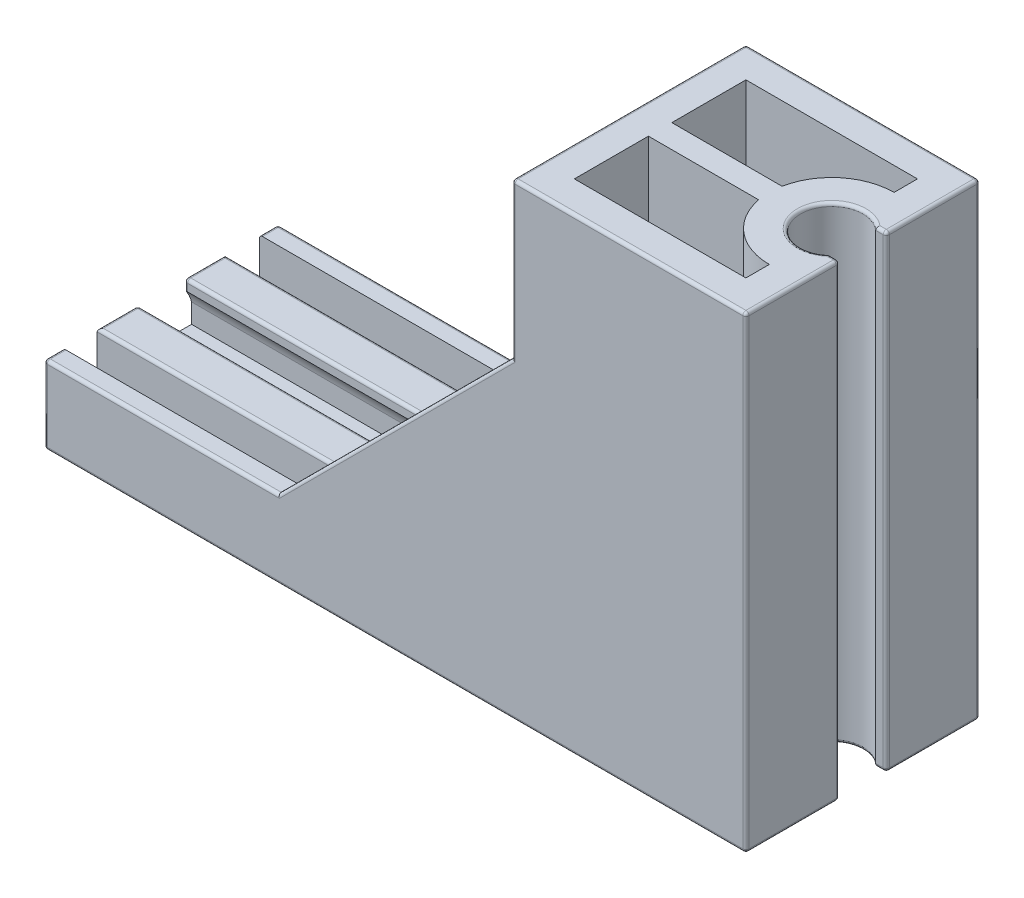
from build123d import *

# Parameters (mm, degrees)
SKETCH_1_W                     = 15
SKETCH_1_H                     = 15
EXTRUDE_1_DEPTH                = 30
CUT_EXTRUDE_1_DEPTH            = 32.819805153
SKETCH_3_W                     = 15
SKETCH_3_H                     = 5
EXTRUDE_2_DEPTH                = 30
SKETCH_4_W                     = 2.2
SKETCH_4_H                     = 2.8
CUT_EXTRUDE_2_DEPTH            = 30
CUT_EXTRUDE_3_DEPTH            = 28.5
EXTRUDE_3_DEPTH                = 3
CUT_EXTRUDE_4_DEPTH            = 15
FILLET_1_R                     = 0.1
PATTERN_LINEAR_1_COUNT         = 3
PATTERN_LINEAR_1_PITCH         = 15
FILLET_1_OF_PATTERN_LINEAR_1_R = 0.1
EXTRUDE_4_DEPTH                = 1.2
FILLET_3_R                     = 0.2
FILLET_4_R                     = 0.2
FILLET_5_R                     = 0.2
FILLET_6_R                     = 0.2
FILLET_7_R                     = 0.2
FILLET_8_R                     = 0.2


with BuildPart() as part:
    # 草图1 → 凸台-拉伸1 (new body)
    with BuildSketch(Plane(origin=(0, 0, 0), x_dir=(1, 0, 0), z_dir=(0, 1, 0))):
        Rectangle(SKETCH_1_W, SKETCH_1_H)
    extrude(amount=EXTRUDE_1_DEPTH)

    # 草图2 → 切除-拉伸1 (cut, through all)
    with BuildSketch(Plane(origin=(0, 30, 0), x_dir=(1, 0, 0), z_dir=(0, 1, 0))):
        with BuildLine():
            Line((7.5, -1.5), (7.5, 1.5))
            Line((7.5, 1.5), (6.822875656, 1.5))
            ThreePointArc((6.822875656, 1.5), (3.5, 0), (6.822875656, -1.5))
            Line((6.822875656, -1.5), (7.5, -1.5))
        make_face()
    extrude(amount=-CUT_EXTRUDE_1_DEPTH, mode=Mode.SUBTRACT)

    # 草图3 → 凸台-拉伸2 (add)
    with BuildSketch(Plane.ZY.offset(7.5)):
        with Locations((0, 2.5)):
            Rectangle(SKETCH_3_W, SKETCH_3_H)
    extrude(amount=EXTRUDE_2_DEPTH)

    # 草图4 → 切除-拉伸2 (cut)
    with BuildSketch(Plane.ZY.offset(37.5)):
        with BuildLine():
            Line((-1.5, 5), (1.5, 5))
            Line((1.5, 5), (1.5, 4.322875656))
            ThreePointArc((1.5, 4.322875656), (1.780042303, 3.911838473), (1.95, 3.444409721))
            Line((1.95, 3.444409721), (1.95, 2.2))
            Line((1.95, 2.2), (-1.95, 2.2))
            Line((-1.95, 2.2), (-1.95, 3.444409721))
            ThreePointArc((-1.95, 3.444409721), (-1.780042303, 3.911838473), (-1.5, 4.322875656))
            Line((-1.5, 4.322875656), (-1.5, 5))
        make_face()
        with Locations((5.2, 3.6)):
            Rectangle(SKETCH_4_W, SKETCH_4_H)
        with Locations((-5.2, 3.6)):
            Rectangle(SKETCH_4_W, SKETCH_4_H)
    extrude(amount=-CUT_EXTRUDE_2_DEPTH, mode=Mode.SUBTRACT)

    # 草图5 → 切除-拉伸3 (cut)
    with BuildSketch(Plane(origin=(0, 30, 0), x_dir=(1, 0, 0), z_dir=(0, 1, 0))):
        with BuildLine():
            Line((5.5, -5.5), (5.5, -4))
            ThreePointArc((5.5, -4), (2.951667212, -3.083180176), (1.571515432, -0.753))
            Line((1.571515432, -0.753), (-5.5, -0.753))
            Line((-5.5, -0.753), (-5.5, -5.5))
            Line((-5.5, -5.5), (5.5, -5.5))
        make_face()
        with BuildLine():
            Line((5.5, 4), (5.5, 5.5))
            Line((5.5, 5.5), (-5.5, 5.5))
            Line((-5.5, 5.5), (-5.5, 0.75))
            Line((-5.5, 0.75), (1.570941589, 0.75))
            ThreePointArc((1.570941589, 0.75), (2.950490243, 3.082207001), (5.5, 4))
        make_face()
    extrude(amount=-CUT_EXTRUDE_3_DEPTH, mode=Mode.SUBTRACT)

    # 草图6 → 凸台-拉伸3 (add, symmetric)
    with BuildSketch(Plane.XY):
        with BuildLine():
            Line((-31.5, 0), (-28.5, 0))
            Line((-28.5, 0), (-28.5, -0.677124344))
            ThreePointArc((-28.5, -0.677124344), (-28.219957697, -1.088161527), (-28.05, -1.555590279))
            Line((-28.05, -1.555590279), (-28.05, -2.5))
            Line((-28.05, -2.5), (-31.95, -2.5))
            Line((-31.95, -2.5), (-31.95, -1.555590279))
            ThreePointArc((-31.95, -1.555590279), (-31.780042303, -1.088161527), (-31.5, -0.677124344))
            Line((-31.5, -0.677124344), (-31.5, 0))
        make_face()
    extrude_3 = extrude(amount=EXTRUDE_3_DEPTH, both=True)

    # 草图7 → 切除-拉伸4 (cut)
    with BuildSketch(Plane.ZY.offset(37.5)):
        with BuildLine():
            Line((3, -2.5), (1.95, -2.5))
            Line((1.95, -2.5), (1.95, -1.555590279))
            ThreePointArc((1.95, -1.555590279), (1.780042303, -1.088161527), (1.5, -0.677124344))
            Line((1.5, -0.677124344), (1.5, 0))
            Line((1.5, 0), (3, 0))
            Line((3, 0), (3, -2.5))
        make_face()
        with BuildLine():
            Line((-1.5, 0), (-1.5, -0.677124344))
            ThreePointArc((-1.5, -0.677124344), (-1.780042303, -1.088161527), (-1.95, -1.555590279))
            Line((-1.95, -1.555590279), (-1.95, -2.5))
            Line((-1.95, -2.5), (-3, -2.5))
            Line((-3, -2.5), (-3, 0))
            Line((-3, 0), (-1.5, 0))
        make_face()
    cut_extrude_4 = extrude(amount=-CUT_EXTRUDE_4_DEPTH, mode=Mode.SUBTRACT)

    # 圆角1
    fillet_1_edges = [part.edges().sort_by_distance(p)[0] for p in [
        (-30, -2.5, 1.95),
        (-31.95, -2.5, 0),
        (-28.05, -2.5, 0),
        (-30, -2.5, -1.95),
    ]]
    fillet(fillet_1_edges, radius=FILLET_1_R)

    # 阵列(线性)1: 凸台-拉伸3, 切除-拉伸4 ×3
    with Locations(*[(i * PATTERN_LINEAR_1_PITCH, 0, 0) for i in range(1, PATTERN_LINEAR_1_COUNT)]):
        add(extrude_3)
        add(cut_extrude_4, mode=Mode.SUBTRACT)

    # 圆角1 of 阵列(线性)1
    fillet_1_of_pattern_linear_1_edges = [part.edges().sort_by_distance(p)[0] for p in [
        (-15, -2.5, 1.95),
        (-16.95, -2.5, 0),
        (-13.05, -2.5, 0),
        (-15, -2.5, -1.95),
        (0, -2.5, 1.95),
        (-1.95, -2.5, 0),
        (1.95, -2.5, 0),
        (0, -2.5, -1.95),
    ]]
    fillet(fillet_1_of_pattern_linear_1_edges, radius=FILLET_1_OF_PATTERN_LINEAR_1_R)

    # 草图8 → 凸台-拉伸4 (add)
    with BuildSketch(Plane.XY.offset(7.5)):
        Polygon((-7.5, 5), (-7.5, 20), (-22.5, 5), align=None)
    extrude_4 = extrude(amount=-EXTRUDE_4_DEPTH)

    # 镜向1: 凸台-拉伸4 across plane
    add(extrude_4.mirror(Plane.XY))

    # 圆角3
    fillet_3_edges = [part.edges().sort_by_distance(p)[0] for p in [
        (7.5, 15, 1.5),
        (7.5, 15, -1.5),
    ]]
    fillet(fillet_3_edges, radius=FILLET_3_R)

    # 圆角4
    fillet_4_edges = [part.edges().sort_by_distance(p)[0] for p in [
        (0, 30, -7.5),
        (7.5, 30, -4.6),
        (7.441421356, 30, -1.558578644),
        (7.061437828, 30, -1.5),
        (3.5, 30, 0),
        (7.061437828, 30, 1.5),
        (7.441421356, 30, 1.558578644),
        (7.5, 30, 4.6),
        (0, 30, 7.5),
        (-7.5, 30, 0),
    ]]
    fillet(fillet_4_edges, radius=FILLET_4_R)

    # 圆角5
    # the kernel refuses this fillet: 0.2 mm, written as the material it takes off along each edge
    with BuildSketch(Plane(origin=(7.3, 29.8, 7.3), x_dir=(0, 0, 1), z_dir=(1, 0, 0))) as fillet_5_piece_1_section:
        Polygon((0, 0), (FILLET_5_R, 0), (FILLET_5_R, -FILLET_5_R), (0, -FILLET_5_R), align=None)
    fillet_5_piece_1 = extrude(amount=FILLET_5_R, mode=Mode.PRIVATE)
    fillet_5_piece_1 = fillet_5_piece_1 - Plane(origin=(7.3, 29.8, 7.3), x_dir=(0, -0.7071067811865475, -0.7071067811865475), z_dir=(1, 0, 0)) * Sphere(FILLET_5_R, mode=Mode.PRIVATE)
    add(fillet_5_piece_1, mode=Mode.SUBTRACT)
    with BuildSketch(Plane(origin=(7.3, 29.8, -7.3), x_dir=(1, 0, 0), z_dir=(0, 0, -1))) as fillet_5_piece_2_section:
        Polygon((0, 0), (FILLET_5_R, 0), (FILLET_5_R, -FILLET_5_R), (0, -FILLET_5_R), align=None)
    fillet_5_piece_2 = extrude(amount=FILLET_5_R, mode=Mode.PRIVATE)
    fillet_5_piece_2 = fillet_5_piece_2 - Plane(origin=(7.3, 29.8, -7.3), x_dir=(-0.7071067811865475, -0.7071067811865475, 0), z_dir=(0, 0, -1)) * Sphere(FILLET_5_R, mode=Mode.PRIVATE)
    add(fillet_5_piece_2, mode=Mode.SUBTRACT)
    with BuildSketch(Plane(origin=(7.3, 0.2, -7.3), x_dir=(0, -1, 0), z_dir=(0, 0, -1))) as fillet_5_piece_3_section:
        Polygon((0, 0), (FILLET_5_R, 0), (FILLET_5_R, -FILLET_5_R), (0, -FILLET_5_R), align=None)
    fillet_5_piece_3 = extrude(amount=FILLET_5_R, mode=Mode.PRIVATE)
    fillet_5_piece_3 = fillet_5_piece_3 - Plane(origin=(7.3, 0.2, -7.3), x_dir=(-0.7071067811865475, 0.7071067811865475, 0), z_dir=(0, 0, -1)) * Sphere(FILLET_5_R, mode=Mode.PRIVATE)
    add(fillet_5_piece_3, mode=Mode.SUBTRACT)
    with BuildSketch(Plane(origin=(7.3, 0.2, 7.3), x_dir=(0, -1, 0), z_dir=(1, 0, 0))) as fillet_5_piece_4_section:
        Polygon((0, 0), (FILLET_5_R, 0), (FILLET_5_R, -FILLET_5_R), (0, -FILLET_5_R), align=None)
    fillet_5_piece_4 = extrude(amount=FILLET_5_R, mode=Mode.PRIVATE)
    fillet_5_piece_4 = fillet_5_piece_4 - Plane(origin=(7.3, 0.2, 7.3), x_dir=(0, 0.7071067811865475, -0.7071067811865475), z_dir=(1, 0, 0)) * Sphere(FILLET_5_R, mode=Mode.PRIVATE)
    add(fillet_5_piece_4, mode=Mode.SUBTRACT)
    with BuildSketch(Plane(origin=(6.322875656, 0, 1.5), x_dir=(0, 0, 1), z_dir=(1, 0, 0)), Plane(origin=(7.3, 0, -1.5), x_dir=(0, 0, -1), z_dir=(-1, 0, 0))) as fillet_5_piece_5:
        with BuildLine():
            CenterArc((FILLET_5_R, -FILLET_5_R), FILLET_5_R, 90, 90)
            Line((0, -FILLET_5_R), (0, 0))
            Line((0, 0), (FILLET_5_R, 0))
        make_face()
    extrude(amount=0.977124344, mode=Mode.SUBTRACT)
    with BuildSketch(Plane(origin=(5.5, 0, 0), x_dir=(0.8269112079398371, 0, -0.562332512116701), z_dir=(0.562332512116701, 0, 0.8269112079398371))) as fillet_5_piece_6:
        with BuildLine():
            CenterArc((2 + FILLET_5_R, FILLET_5_R), FILLET_5_R, 180, 90)
            Line((2, FILLET_5_R), (2, 0))
            Line((2, 0), (2 + FILLET_5_R, 0))
        make_face()
    revolve(axis=Axis((5.5, 0, 0), (0, 1, 0)), revolution_arc=291.56547905, mode=Mode.SUBTRACT)
    with BuildSketch(Plane(origin=(-37.5, 0, 8), x_dir=(1, 0, 0), z_dir=(0, 0, -1))) as fillet_5_piece_7:
        with BuildLine():
            CenterArc((FILLET_5_R, -FILLET_5_R), FILLET_5_R, 90, 90)
            Line((0, -FILLET_5_R), (0, 0))
            Line((0, 0), (FILLET_5_R, 0))
        make_face()
    extrude(amount=16, mode=Mode.SUBTRACT)
    with BuildSketch(Plane(origin=(7.5, 0, -7.3), x_dir=(-1, 0, 0), z_dir=(0, 0, 1))) as fillet_5_piece_8:
        with BuildLine():
            CenterArc((FILLET_5_R, -FILLET_5_R), FILLET_5_R, 90, 90)
            Line((0, -FILLET_5_R), (0, 0))
            Line((0, 0), (FILLET_5_R, 0))
        make_face()
    extrude(amount=5.6, mode=Mode.SUBTRACT)
    with BuildSketch(Plane(origin=(7.3, 0, -1.7), x_dir=(1, 0, 0), z_dir=(0, 0, -1))) as fillet_5_piece_9:
        with BuildLine():
            CenterArc((0.2 - FILLET_5_R, -FILLET_5_R), FILLET_5_R, 0, 90)
            Line((0.2, -FILLET_5_R), (0.2, 0))
            Line((0.2, 0), (0.2 - FILLET_5_R, 0))
        make_face()
    revolve(axis=Axis((7.3, 0, -1.7), (0, -1, 0)), revolution_arc=90, mode=Mode.SUBTRACT)
    with BuildSketch(Plane(origin=(7.3, 0, 1.7), x_dir=(0, 0, -1), z_dir=(-1, 0, 0))) as fillet_5_piece_10:
        with BuildLine():
            CenterArc((0.2 - FILLET_5_R, -FILLET_5_R), FILLET_5_R, 0, 90)
            Line((0.2 - FILLET_5_R, 0), (0.2, 0))
            Line((0.2, 0), (0.2, -FILLET_5_R))
        make_face()
    revolve(axis=Axis((7.3, 0, 1.7), (0, -1, 0)), revolution_arc=90, mode=Mode.SUBTRACT)
    with BuildSketch(Plane(origin=(7.5, 0.2, -7.5), x_dir=(-1, 0, 0), z_dir=(0, 1, 0)), Plane(origin=(7.5, 0.2, 7.5), x_dir=(0, 0, -1), z_dir=(0, 1, 0))) as fillet_5_piece_11:
        with BuildLine():
            CenterArc((FILLET_5_R, FILLET_5_R), FILLET_5_R, 180, 90)
            Line((0, FILLET_5_R), (0, 0))
            Line((0, 0), (FILLET_5_R, 0))
        make_face()
    extrude(amount=29.6, mode=Mode.SUBTRACT)
    with BuildSketch(Plane(origin=(-38, 0, -7.5), x_dir=(0, 0, 1), z_dir=(1, 0, 0)), Plane(origin=(7.3, 0, 7.5), x_dir=(0, 0, -1), z_dir=(-1, 0, 0))) as fillet_5_piece_12:
        with BuildLine():
            CenterArc((FILLET_5_R, -FILLET_5_R), FILLET_5_R, 90, 90)
            Line((0, -FILLET_5_R), (0, 0))
            Line((0, 0), (FILLET_5_R, 0))
        make_face()
    extrude(amount=45.3, mode=Mode.SUBTRACT)
    with BuildSketch(Plane(origin=(7.5, 0, 1.7), x_dir=(0, 1, 0), z_dir=(0, 0, 1))) as fillet_5_piece_13:
        with BuildLine():
            CenterArc((FILLET_5_R, FILLET_5_R), FILLET_5_R, 180, 90)
            Line((0, FILLET_5_R), (0, 0))
            Line((0, 0), (FILLET_5_R, 0))
        make_face()
    extrude(amount=5.6, mode=Mode.SUBTRACT)

    # 圆角6
    # the kernel refuses this fillet: 0.2 mm, written as the material it takes off along each edge
    with BuildSketch(Plane(origin=(-7.3, 29.8, 7.3), x_dir=(-1, 0, 0), z_dir=(0, 0, 1))) as fillet_6_piece_1_section:
        Polygon((0, 0), (FILLET_6_R, 0), (FILLET_6_R, -FILLET_6_R), (0, -FILLET_6_R), align=None)
    fillet_6_piece_1 = extrude(amount=FILLET_6_R, mode=Mode.PRIVATE)
    fillet_6_piece_1 = fillet_6_piece_1 - Plane(origin=(-7.3, 29.8, 7.3), x_dir=(0.7071067811865475, -0.7071067811865475, 0), z_dir=(0, 0, 1)) * Sphere(FILLET_6_R, mode=Mode.PRIVATE)
    add(fillet_6_piece_1, mode=Mode.SUBTRACT)
    with BuildSketch(Plane(origin=(-7.3, 29.8, -7.3), x_dir=(0, 0, -1), z_dir=(-1, 0, 0))) as fillet_6_piece_2_section:
        Polygon((0, 0), (FILLET_6_R, 0), (FILLET_6_R, -FILLET_6_R), (0, -FILLET_6_R), align=None)
    fillet_6_piece_2 = extrude(amount=FILLET_6_R, mode=Mode.PRIVATE)
    fillet_6_piece_2 = fillet_6_piece_2 - Plane(origin=(-7.3, 29.8, -7.3), x_dir=(0, -0.7071067811865475, 0.7071067811865475), z_dir=(-1, 0, 0)) * Sphere(FILLET_6_R, mode=Mode.PRIVATE)
    add(fillet_6_piece_2, mode=Mode.SUBTRACT)
    with BuildSketch(Plane(origin=(-37.3, 0.2, 7.3), x_dir=(-1, 0, 0), z_dir=(0, 0, 1))) as fillet_6_piece_3_section:
        Polygon((0, 0), (FILLET_6_R, 0), (FILLET_6_R, FILLET_6_R), (0, FILLET_6_R), align=None)
    fillet_6_piece_3 = extrude(amount=FILLET_6_R, mode=Mode.PRIVATE)
    fillet_6_piece_3 = fillet_6_piece_3 - Plane(origin=(-37.3, 0.2, 7.3), x_dir=(0.7071067811865475, 0.7071067811865475, 0), z_dir=(0, 0, 1)) * Sphere(FILLET_6_R, mode=Mode.PRIVATE)
    add(fillet_6_piece_3, mode=Mode.SUBTRACT)
    with BuildSketch(Plane(origin=(-37.3, 0.2, -7.3), x_dir=(0, 0, -1), z_dir=(-1, 0, 0))) as fillet_6_piece_4_section:
        Polygon((0, 0), (FILLET_6_R, 0), (FILLET_6_R, FILLET_6_R), (0, FILLET_6_R), align=None)
    fillet_6_piece_4 = extrude(amount=FILLET_6_R, mode=Mode.PRIVATE)
    fillet_6_piece_4 = fillet_6_piece_4 - Plane(origin=(-37.3, 0.2, -7.3), x_dir=(0, 0.7071067811865475, 0.7071067811865475), z_dir=(-1, 0, 0)) * Sphere(FILLET_6_R, mode=Mode.PRIVATE)
    add(fillet_6_piece_4, mode=Mode.SUBTRACT)
    with BuildSketch(Plane(origin=(-22, 5, -7.5), x_dir=(0, -1, 0), z_dir=(-1, 0, 0))) as fillet_6_piece_5_section:
        with BuildLine():
            CenterArc((FILLET_6_R, FILLET_6_R), FILLET_6_R, 180, 90)
            Line((0, FILLET_6_R), (0, 0))
            Line((0, 0), (FILLET_6_R, 0))
        make_face()
    fillet_6_piece_5 = extrude(amount=16, mode=Mode.PRIVATE)
    fillet_6_piece_5 = split(fillet_6_piece_5, bisect_by=Plane(origin=(-26.408869049, 1.091130951, -7.454649914), z_dir=(-0.7071067811865476, 0.7071067811865475, 0)), keep=Keep.TOP, mode=Mode.PRIVATE)
    add(fillet_6_piece_5, mode=Mode.SUBTRACT)
    with BuildSketch(Plane(origin=(-22, 5, 7.5), x_dir=(0, -1, 0), z_dir=(-1, 0, 0))) as fillet_6_piece_6_section:
        with BuildLine():
            CenterArc((FILLET_6_R, -FILLET_6_R), FILLET_6_R, 90, 90)
            Line((0, -FILLET_6_R), (0, 0))
            Line((0, 0), (FILLET_6_R, 0))
        make_face()
    fillet_6_piece_6 = extrude(amount=16, mode=Mode.PRIVATE)
    fillet_6_piece_6 = split(fillet_6_piece_6, bisect_by=Plane(origin=(-26.408869049, 1.091130951, 7.454649914), z_dir=(-0.7071067811865476, 0.7071067811865475, 0)), keep=Keep.TOP, mode=Mode.PRIVATE)
    add(fillet_6_piece_6, mode=Mode.SUBTRACT)
    with BuildSketch(Plane(origin=(-37.5, 5.5, -7.5), x_dir=(0, 0, 1), z_dir=(0, -1, 0))) as fillet_6_piece_7:
        with BuildLine():
            CenterArc((FILLET_6_R, -FILLET_6_R), FILLET_6_R, 90, 90)
            Line((0, -FILLET_6_R), (0, 0))
            Line((0, 0), (FILLET_6_R, 0))
        make_face()
    extrude(amount=5.3, mode=Mode.SUBTRACT)
    with BuildSketch(Plane(origin=(-7.146446609, 20.353553391, 7.5), x_dir=(0.7071067811865476, -0.7071067811865476, 0), z_dir=(-0.7071067811865475, -0.7071067811865476, 0))) as fillet_6_piece_8_section:
        with BuildLine():
            CenterArc((FILLET_6_R, -FILLET_6_R), FILLET_6_R, 90, 90)
            Line((0, -FILLET_6_R), (0, 0))
            Line((0, 0), (FILLET_6_R, 0))
        make_face()
    fillet_6_piece_8 = extrude(amount=22.213203436, mode=Mode.PRIVATE)
    fillet_6_piece_8 = split(fillet_6_piece_8, bisect_by=Plane(origin=(-7.5, 12.468107365, 7.454616988), z_dir=(-1, 0, 0)), keep=Keep.TOP, mode=Mode.PRIVATE)
    fillet_6_piece_8 = split(fillet_6_piece_8, bisect_by=Plane(origin=(-14.968107365, 5, 7.454616988), z_dir=(0, 1, 0)), keep=Keep.TOP, mode=Mode.PRIVATE)
    add(fillet_6_piece_8, mode=Mode.SUBTRACT)
    with BuildSketch(Plane(origin=(-7.146446609, 20.353553391, -7.5), x_dir=(0.7071067811865476, -0.7071067811865476, 0), z_dir=(-0.7071067811865475, -0.7071067811865476, 0))) as fillet_6_piece_9_section:
        with BuildLine():
            CenterArc((FILLET_6_R, FILLET_6_R), FILLET_6_R, 180, 90)
            Line((0, FILLET_6_R), (0, 0))
            Line((0, 0), (FILLET_6_R, 0))
        make_face()
    fillet_6_piece_9 = extrude(amount=22.213203436, mode=Mode.PRIVATE)
    fillet_6_piece_9 = split(fillet_6_piece_9, bisect_by=Plane(origin=(-7.5, 12.468107365, -7.454616988), z_dir=(-1, 0, 0)), keep=Keep.TOP, mode=Mode.PRIVATE)
    fillet_6_piece_9 = split(fillet_6_piece_9, bisect_by=Plane(origin=(-14.968107365, 5, -7.454616988), z_dir=(0, 1, 0)), keep=Keep.TOP, mode=Mode.PRIVATE)
    add(fillet_6_piece_9, mode=Mode.SUBTRACT)
    with BuildSketch(Plane(origin=(-7.5, 19.5, -7.5), x_dir=(0, 0, 1), z_dir=(0, 1, 0))) as fillet_6_piece_10_section:
        with BuildLine():
            CenterArc((FILLET_6_R, FILLET_6_R), FILLET_6_R, 180, 90)
            Line((0, FILLET_6_R), (0, 0))
            Line((0, 0), (FILLET_6_R, 0))
        make_face()
    fillet_6_piece_10 = extrude(amount=10.3, mode=Mode.PRIVATE)
    fillet_6_piece_10 = split(fillet_6_piece_10, bisect_by=Plane(origin=(-5.016183669, 22.483816331, -7.454608389), z_dir=(-0.7071067811865476, 0.7071067811865475, 0)), keep=Keep.TOP, mode=Mode.PRIVATE)
    add(fillet_6_piece_10, mode=Mode.SUBTRACT)
    with BuildSketch(Plane(origin=(-7.5, 19.5, 7.5), x_dir=(1, 0, 0), z_dir=(0, 1, 0))) as fillet_6_piece_11_section:
        with BuildLine():
            CenterArc((FILLET_6_R, FILLET_6_R), FILLET_6_R, 180, 90)
            Line((0, FILLET_6_R), (0, 0))
            Line((0, 0), (FILLET_6_R, 0))
        make_face()
    fillet_6_piece_11 = extrude(amount=10.3, mode=Mode.PRIVATE)
    fillet_6_piece_11 = split(fillet_6_piece_11, bisect_by=Plane(origin=(-5.016183669, 22.483816331, 7.454608389), z_dir=(-0.7071067811865476, 0.7071067811865475, 0)), keep=Keep.TOP, mode=Mode.PRIVATE)
    add(fillet_6_piece_11, mode=Mode.SUBTRACT)
    with BuildSketch(Plane(origin=(-37.5, 0.2, 7.5), x_dir=(1, 0, 0), z_dir=(0, 1, 0))) as fillet_6_piece_12:
        with BuildLine():
            CenterArc((FILLET_6_R, FILLET_6_R), FILLET_6_R, 180, 90)
            Line((0, FILLET_6_R), (0, 0))
            Line((0, 0), (FILLET_6_R, 0))
        make_face()
    extrude(amount=5.3, mode=Mode.SUBTRACT)
    with BuildSketch(Plane(origin=(-22, 5, -7.5), x_dir=(0, -1, 0), z_dir=(-1, 0, 0))) as fillet_6_piece_13a_section:
        with BuildLine():
            CenterArc((FILLET_6_R, FILLET_6_R), FILLET_6_R, 180, 90)
            Line((0, FILLET_6_R), (0, 0))
            Line((0, 0), (FILLET_6_R, 0))
        make_face()
    fillet_6_piece_13a = extrude(amount=16, mode=Mode.PRIVATE)
    fillet_6_piece_13a = split(fillet_6_piece_13a, bisect_by=Plane(origin=(-22.411516303, 5.088483697, -7.456735116), z_dir=(0.7071067811865476, -0.7071067811865475, 0)), keep=Keep.TOP, mode=Mode.PRIVATE)
    with BuildSketch(Plane(origin=(-7.146446609, 20.353553391, -7.5), x_dir=(0.7071067811865476, -0.7071067811865476, 0), z_dir=(-0.7071067811865475, -0.7071067811865476, 0))) as fillet_6_piece_13b_section:
        with BuildLine():
            CenterArc((FILLET_6_R, FILLET_6_R), FILLET_6_R, 180, 90)
            Line((0, FILLET_6_R), (0, 0))
            Line((0, 0), (FILLET_6_R, 0))
        make_face()
    fillet_6_piece_13b = extrude(amount=22.213203436, mode=Mode.PRIVATE)
    fillet_6_piece_13b = split(fillet_6_piece_13b, bisect_by=Plane(origin=(-22.625134844, 5, -7.456735116), z_dir=(0, -1, 0)), keep=Keep.TOP, mode=Mode.PRIVATE)
    fillet_6_piece_13 = fillet_6_piece_13a & fillet_6_piece_13b
    add(fillet_6_piece_13, mode=Mode.SUBTRACT)
    with BuildSketch(Plane(origin=(-7.146446609, 20.353553391, 7.5), x_dir=(0.7071067811865476, -0.7071067811865476, 0), z_dir=(-0.7071067811865475, -0.7071067811865476, 0))) as fillet_6_piece_14a_section:
        with BuildLine():
            CenterArc((FILLET_6_R, -FILLET_6_R), FILLET_6_R, 90, 90)
            Line((0, -FILLET_6_R), (0, 0))
            Line((0, 0), (FILLET_6_R, 0))
        make_face()
    fillet_6_piece_14a = extrude(amount=22.213203436, mode=Mode.PRIVATE)
    fillet_6_piece_14a = split(fillet_6_piece_14a, bisect_by=Plane(origin=(-22.625134844, 5, 7.456735116), z_dir=(0, -1, 0)), keep=Keep.TOP, mode=Mode.PRIVATE)
    with BuildSketch(Plane(origin=(-22, 5, 7.5), x_dir=(0, -1, 0), z_dir=(-1, 0, 0))) as fillet_6_piece_14b_section:
        with BuildLine():
            CenterArc((FILLET_6_R, -FILLET_6_R), FILLET_6_R, 90, 90)
            Line((0, -FILLET_6_R), (0, 0))
            Line((0, 0), (FILLET_6_R, 0))
        make_face()
    fillet_6_piece_14b = extrude(amount=16, mode=Mode.PRIVATE)
    fillet_6_piece_14b = split(fillet_6_piece_14b, bisect_by=Plane(origin=(-22.411516303, 5.088483697, 7.456735116), z_dir=(0.7071067811865476, -0.7071067811865475, 0)), keep=Keep.TOP, mode=Mode.PRIVATE)
    fillet_6_piece_14 = fillet_6_piece_14a & fillet_6_piece_14b
    add(fillet_6_piece_14, mode=Mode.SUBTRACT)
    with BuildSketch(Plane(origin=(-7.5, 19.5, 7.5), x_dir=(1, 0, 0), z_dir=(0, 1, 0))) as fillet_6_piece_15a_section:
        with BuildLine():
            CenterArc((FILLET_6_R, FILLET_6_R), FILLET_6_R, 180, 90)
            Line((0, FILLET_6_R), (0, 0))
            Line((0, 0), (FILLET_6_R, 0))
        make_face()
    fillet_6_piece_15a = extrude(amount=10.3, mode=Mode.PRIVATE)
    fillet_6_piece_15a = split(fillet_6_piece_15a, bisect_by=Plane(origin=(-7.588483697, 19.911516303, 7.456735116), z_dir=(0.7071067811865476, -0.7071067811865475, 0)), keep=Keep.TOP, mode=Mode.PRIVATE)
    with BuildSketch(Plane(origin=(-7.146446609, 20.353553391, 7.5), x_dir=(0.7071067811865476, -0.7071067811865476, 0), z_dir=(-0.7071067811865475, -0.7071067811865476, 0))) as fillet_6_piece_15b_section:
        with BuildLine():
            CenterArc((FILLET_6_R, -FILLET_6_R), FILLET_6_R, 90, 90)
            Line((0, -FILLET_6_R), (0, 0))
            Line((0, 0), (FILLET_6_R, 0))
        make_face()
    fillet_6_piece_15b = extrude(amount=22.213203436, mode=Mode.PRIVATE)
    fillet_6_piece_15b = split(fillet_6_piece_15b, bisect_by=Plane(origin=(-7.5, 20.125134844, 7.456735116), z_dir=(1, 0, 0)), keep=Keep.TOP, mode=Mode.PRIVATE)
    fillet_6_piece_15 = fillet_6_piece_15a & fillet_6_piece_15b
    add(fillet_6_piece_15, mode=Mode.SUBTRACT)
    with BuildSketch(Plane(origin=(-7.5, 19.5, -7.5), x_dir=(0, 0, 1), z_dir=(0, 1, 0))) as fillet_6_piece_16a_section:
        with BuildLine():
            CenterArc((FILLET_6_R, FILLET_6_R), FILLET_6_R, 180, 90)
            Line((0, FILLET_6_R), (0, 0))
            Line((0, 0), (FILLET_6_R, 0))
        make_face()
    fillet_6_piece_16a = extrude(amount=10.3, mode=Mode.PRIVATE)
    fillet_6_piece_16a = split(fillet_6_piece_16a, bisect_by=Plane(origin=(-7.588483697, 19.911516303, -7.456735116), z_dir=(0.7071067811865476, -0.7071067811865475, 0)), keep=Keep.TOP, mode=Mode.PRIVATE)
    with BuildSketch(Plane(origin=(-7.146446609, 20.353553391, -7.5), x_dir=(0.7071067811865476, -0.7071067811865476, 0), z_dir=(-0.7071067811865475, -0.7071067811865476, 0))) as fillet_6_piece_16b_section:
        with BuildLine():
            CenterArc((FILLET_6_R, FILLET_6_R), FILLET_6_R, 180, 90)
            Line((0, FILLET_6_R), (0, 0))
            Line((0, 0), (FILLET_6_R, 0))
        make_face()
    fillet_6_piece_16b = extrude(amount=22.213203436, mode=Mode.PRIVATE)
    fillet_6_piece_16b = split(fillet_6_piece_16b, bisect_by=Plane(origin=(-7.5, 20.125134844, -7.456735116), z_dir=(1, 0, 0)), keep=Keep.TOP, mode=Mode.PRIVATE)
    fillet_6_piece_16 = fillet_6_piece_16a & fillet_6_piece_16b
    add(fillet_6_piece_16, mode=Mode.SUBTRACT)

    # 圆角7
    # the kernel refuses this fillet: 0.2 mm, written as the material it takes off along each edge
    with BuildSketch(Plane(origin=(-37.3, 4.8, 7.3), x_dir=(-1, 0, 0), z_dir=(0, 1, 0))) as fillet_7_piece_1_section:
        Polygon((0, 0), (FILLET_7_R, 0), (FILLET_7_R, FILLET_7_R), (0, FILLET_7_R), align=None)
    fillet_7_piece_1 = extrude(amount=FILLET_7_R, mode=Mode.PRIVATE)
    fillet_7_piece_1 = fillet_7_piece_1 - Plane(origin=(-37.3, 4.8, 7.3), x_dir=(0.7071067811865475, 0, -0.7071067811865476), z_dir=(0, 1, 0)) * Sphere(FILLET_7_R, mode=Mode.PRIVATE)
    add(fillet_7_piece_1, mode=Mode.SUBTRACT)
    with BuildSketch(Plane(origin=(-37.3, 4.8, -7.3), x_dir=(0, 1, 0), z_dir=(-1, 0, 0))) as fillet_7_piece_2_section:
        Polygon((0, 0), (FILLET_7_R, 0), (FILLET_7_R, FILLET_7_R), (0, FILLET_7_R), align=None)
    fillet_7_piece_2 = extrude(amount=FILLET_7_R, mode=Mode.PRIVATE)
    fillet_7_piece_2 = fillet_7_piece_2 - Plane(origin=(-37.3, 4.8, -7.3), x_dir=(0, -0.7071067811865475, 0.7071067811865475), z_dir=(-1, 0, 0)) * Sphere(FILLET_7_R, mode=Mode.PRIVATE)
    add(fillet_7_piece_2, mode=Mode.SUBTRACT)
    with BuildSketch(Plane(origin=(-38, 5, -4.1), x_dir=(0, -1, 0), z_dir=(1, 0, 0)), Plane(origin=(-38, 5, 4.1), x_dir=(0, 0, -1), z_dir=(1, 0, 0))) as fillet_7_piece_3:
        with BuildLine():
            CenterArc((FILLET_7_R, -FILLET_7_R), FILLET_7_R, 90, 90)
            Line((0, -FILLET_7_R), (0, 0))
            Line((0, 0), (FILLET_7_R, 0))
        make_face()
    extrude(amount=30.5, mode=Mode.SUBTRACT)
    with BuildSketch(Plane(origin=(-37.5, 5, 7.3), x_dir=(1, 0, 0), z_dir=(0, 0, -1))) as fillet_7_piece_4:
        with BuildLine():
            CenterArc((FILLET_7_R, FILLET_7_R), FILLET_7_R, 180, 90)
            Line((0, FILLET_7_R), (0, 0))
            Line((0, 0), (FILLET_7_R, 0))
        make_face()
    extrude(amount=1.5, mode=Mode.SUBTRACT)
    with BuildSketch(Plane(origin=(-37.5, 5, 4.6), x_dir=(0, -1, 0), z_dir=(0, 0, -1)), Plane(origin=(-37.5, 5, -1), x_dir=(0, -1, 0), z_dir=(0, 0, -1))) as fillet_7_piece_5:
        with BuildLine():
            CenterArc((FILLET_7_R, -FILLET_7_R), FILLET_7_R, 90, 90)
            Line((0, -FILLET_7_R), (0, 0))
            Line((0, 0), (FILLET_7_R, 0))
        make_face()
    extrude(amount=3.6, mode=Mode.SUBTRACT)
    with BuildSketch(Plane(origin=(-37.5, 5, -5.8), x_dir=(0, -1, 0), z_dir=(0, 0, -1))) as fillet_7_piece_6:
        with BuildLine():
            CenterArc((FILLET_7_R, -FILLET_7_R), FILLET_7_R, 90, 90)
            Line((0, -FILLET_7_R), (0, 0))
            Line((0, 0), (FILLET_7_R, 0))
        make_face()
    extrude(amount=1.5, mode=Mode.SUBTRACT)

    # 圆角8
    fillet_8_edges = [part.edges().sort_by_distance(p)[0] for p in [
        (-37.5, 4.561437828, 1.5),
        (-37.441421356, 4.941421356, 1.5),
        (-37.5, 4.561437828, -1.5),
        (-37.441421356, 4.941421356, -1.5),
        (-22.4, 5, 1.5),
        (-22.4, 5, -1.5),
    ]]
    fillet(fillet_8_edges, radius=FILLET_8_R)


solid = part.part
